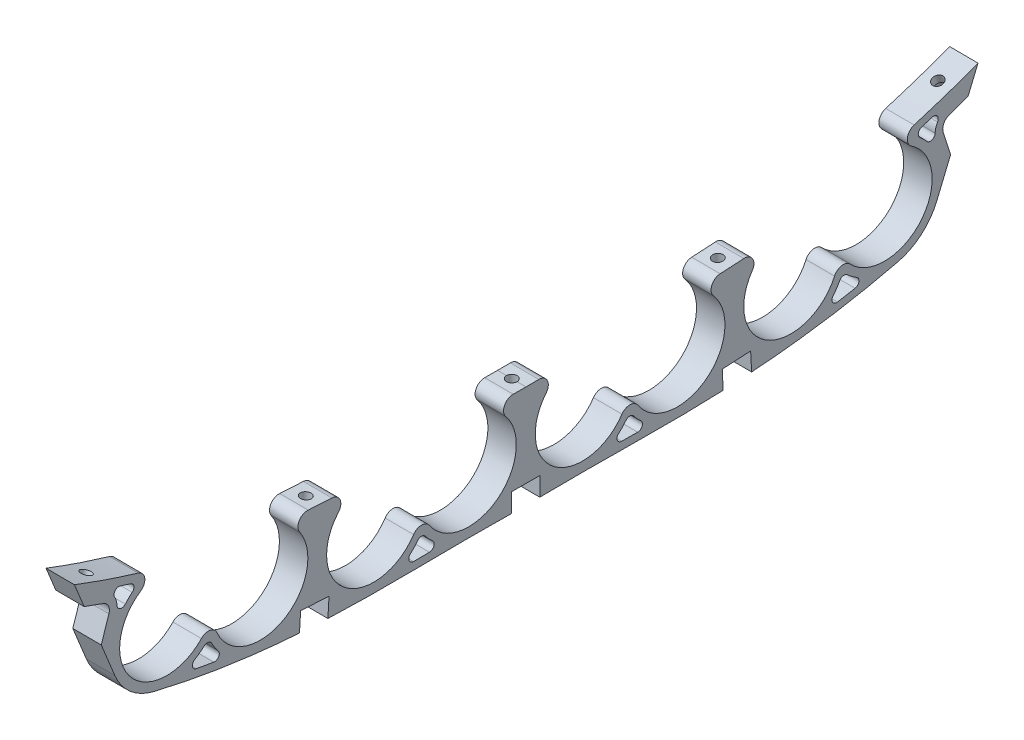
from build123d import *

# Parameters (mm, degrees)
BOSS_EXTRUDE2_DEPTH = 4.7625
CUT_EXTRUDE1_DEPTH  = 156.140004982
SKETCH3_R           = 1.778
CUT_EXTRUDE2_DEPTH  = 155.594652675
SKETCH4_R           = 1.778
CUT_EXTRUDE3_DEPTH  = 154.129887727
SKETCH5_R           = 3.175
CUT_EXTRUDE4_DEPTH  = 3.556
SKETCH6_R           = 1.778
CUT_EXTRUDE5_DEPTH  = 141.448581992


# Read off the part's stored shape, not the designer's step: Mirror1
with BuildPart() as part:
    # Sketch1 → Boss-Extrude2 (new, symmetric)
    with BuildSketch(Plane(origin=(-4.793989049, 0.020738597, -8e-09), x_dir=(-1.5740645192279891e-09, 3.5988585896806374e-12, 1.0), z_dir=(-0.9999906431736159, 0.00432591784689156, -1.5740653593461668e-09))):
        with BuildLine():
            Line((4.097149249, -41.793027475), (4.097149249, -13.684381562))
            add(Edge.make_bspline(
                [(-0.197992817, -13.658197906), (1.233887874, -13.669641114), (2.665596444, -13.67917089), (4.097149249, -13.684381562)],
                knots=[0.973473707, 0.973473707, 0.973473707, 0.973473707, 1, 1, 1, 1], degree=3))
            ThreePointArc((-0.197992817, -13.658197906), (-3.087878671, -15.463720469), (-2.678279853, -18.846556674))
            ThreePointArc((-2.678279853, -18.846556674), (-2.459422116, -19.119477593), (-2.246631473, -19.397154887))
            ThreePointArc((-2.246631473, -19.397154887), (0.109135751, -23.898660497), (0.922149671, -28.913857436))
            ThreePointArc((0.922149671, -28.913857436), (-10.330023088, -44.100861528), (-28.135499878, -37.75882074))
            ThreePointArc((-28.135499878, -37.75882074), (-30.788793596, -36.352857657), (-33.427092785, -37.786760419))
            ThreePointArc((-33.427092785, -37.786760419), (-56.000004834, -41.948908373), (-59.135509194, -19.210648844))
            add(Edge.make_bspline(
                [(-71.253324978, -18.51695643), (-67.22219572, -18.825212212), (-63.182502669, -19.053825628), (-59.135509194, -19.210648845)],
                knots=[0.535293106, 0.535293106, 0.535293106, 0.535293106, 0.609991772, 0.609991772, 0.609991772, 0.609991772], degree=3))
            ThreePointArc((-71.253324978, -18.51695643), (-69.473338821, -22.537426481), (-68.864440234, -26.891938239))
            ThreePointArc((-68.864440234, -26.891938239), (-81.471963152, -42.427034587), (-99.26938115, -33.286970841))
            ThreePointArc((-99.26938115, -33.286970841), (-101.634862692, -31.437323087), (-104.483804941, -32.386126439))
            ThreePointArc((-104.483804941, -32.386126439), (-127.878968465, -32.047286598), (-125.5261293, -8.76826951))
            add(Edge.make_bspline(
                [(-144.126574407, -2.696164985), (-141.693386447, -3.582520341), (-137.657540812, -4.990682155), (-131.449532285, -7.006389931), (-127.680307088, -8.145409373), (-125.5261293, -8.76826951)],
                knots=[0.075396222, 0.075396222, 0.075396222, 0.075396222, 0.123289108, 0.154539108, 0.195826457, 0.195826457, 0.195826457, 0.195826457], degree=3))
            Line((-144.126574407, -2.696164985), (-143.840043853, -3.392907472))
            Line((-143.840043853, -3.392907472), (-137.494598711, -5.665834335))
            ThreePointArc((-137.494598711, -5.665834335), (-135.715347538, -7.255363838), (-135.545390345, -9.635164949))
            Line((-135.545390345, -9.635164949), (-138.072044537, -17.41867238))
            Line((-138.072044537, -17.41867238), (-133.451933082, -28.653173909))
            ThreePointArc((-133.451933082, -28.653173909), (-128.289952657, -35.791230262), (-120.447393147, -39.802732565))
            add(Edge.make_bspline(
                [(-120.447393147, -39.802732565), (-119.532951115, -40.023476944), (-117.088169027, -40.601323697), (-110.953698267, -41.968369708), (-101.9631708, -43.710437587), (-90.800466979, -45.403836777), (-79.689088478, -46.662973433), (-68.62645086, -47.527275454), (-57.58924724, -48.037878216), (-46.678774083, -48.224931934), (-36.12400945, -48.204712413), (-25.891642086, -48.098211972), (-17.621930281, -48.025348577), (-11.245188421, -48.026081616), (-6.353163032, -48.062670944), (-2.777855823, -48.097005295), (-0.863208778, -48.112845404), (-0.665350758, -48.114448781)],
                knots=[0.270797205, 0.270797205, 0.270797205, 0.270797205, 0.286422205, 0.3125, 0.375, 0.4375, 0.5, 0.5625, 0.625, 0.6875, 0.75, 0.8125, 0.875, 0.90625, 0.9375, 0.96875, 0.972344137, 0.972344137, 0.972344137, 0.972344137], degree=3))
            Line((-0.665350758, -48.114448781), (-0.665350758, -43.034495919))
            Line((-0.665350758, -43.034495919), (-0.665350758, -41.793027475))
            Line((-0.665350758, -41.793027475), (4.097149249, -41.793027475))
        make_face()
        with BuildLine():
            add(Edge.make_bspline(
                [(-71.253324978, -18.51695643), (-67.22219572, -18.825212212), (-63.182502669, -19.053825628), (-59.135509194, -19.210648845)],
                knots=[0.535293106, 0.535293106, 0.535293106, 0.535293106, 0.609991772, 0.609991772, 0.609991772, 0.609991772], degree=3))
            ThreePointArc((-59.135509194, -19.210648844), (-58.89906526, -18.919941939), (-58.655825681, -18.634896774))
            ThreePointArc((-58.655825681, -18.634896774), (-58.126924891, -15.297918384), (-60.904121208, -13.373771446))
            add(Edge.make_bspline(
                [(-68.828218087, -12.920284085), (-66.193270159, -13.104549218), (-63.552061633, -13.254900638), (-60.904121208, -13.373771446)],
                knots=[0.547550637, 0.547550637, 0.547550637, 0.547550637, 0.597372825, 0.597372825, 0.597372825, 0.597372825], degree=3))
            ThreePointArc((-68.828218087, -12.920284085), (-71.806956564, -14.513315904), (-71.664664037, -17.888280516))
            ThreePointArc((-71.664664037, -17.888280516), (-71.455274959, -18.200184794), (-71.253324978, -18.51695643))
        make_face()
        with BuildLine():
            add(Edge.make_bspline(
                [(-144.126574407, -2.696164985), (-141.693386447, -3.582520341), (-137.657540812, -4.990682155), (-131.449532285, -7.006389931), (-127.680307088, -8.145409373), (-125.5261293, -8.76826951)],
                knots=[0.075396222, 0.075396222, 0.075396222, 0.075396222, 0.123289108, 0.154539108, 0.195826457, 0.195826457, 0.195826457, 0.195826457], degree=3))
            ThreePointArc((-125.5261293, -8.76826951), (-125.226031085, -8.549532847), (-124.92089854, -8.337875585))
            ThreePointArc((-124.92089854, -8.337875585), (-123.561886671, -5.224741567), (-125.794696479, -2.664843712))
            add(Edge.make_bspline(
                [(-147.137000396, 4.624142263), (-146.051301566, 4.203786415), (-144.963583265, 3.790748153), (-140.77844611, 2.231782933), (-137.662571865, 1.133761933), (-131.631205803, -0.876110443), (-128.721040833, -1.794426019), (-125.794696479, -2.664843712)],
                knots=[0.040485997, 0.040485997, 0.040485997, 0.040485997, 0.0625, 0.0625, 0.125, 0.125, 0.182529251, 0.182529251, 0.182529251, 0.182529251], degree=3))
            Line((-147.137000396, 4.624142263), (-144.126574407, -2.696164985))
        make_face()
    extrude(amount=BOSS_EXTRUDE2_DEPTH, both=True)

    # Sketch2 → Cut-Extrude1 (cut, symmetric)
    with BuildSketch(Plane(origin=(-9.556444487, 0.041340781, -1.5e-08), x_dir=(-1.574050630268585e-09, 6.809277426616461e-12, 1.0), z_dir=(-0.9999906431736159, 0.004325917846891559, -1.5740653585248619e-09))):
        with BuildLine():
            add(Edge.make_bspline(
                [(-128.288911655, -4.550972366), (-128.456661527, -4.498251993), (-129.003884742, -4.325677312), (-129.929643207, -4.030454177), (-130.927193912, -3.707456253), (-131.545372343, -3.504823848), (-131.785481644, -3.425746569)],
                knots=[0.050478375, 0.050478375, 0.050478375, 0.050478375, 0.053922838, 0.061719646, 0.069516453, 0.074472634, 0.074472634, 0.074472634, 0.074472634], degree=3))
            ThreePointArc((-131.785481644, -3.425746569), (-133.519336235, -3.938929798), (-133.647980943, -5.742553735))
            ThreePointArc((-133.647980943, -5.742553735), (-133.066520265, -7.097609192), (-132.851113315, -8.556331804))
            ThreePointArc((-132.851113315, -8.556331804), (-131.798846355, -10.023596818), (-130.05449481, -9.557367191))
            ThreePointArc((-130.05449481, -9.557367191), (-128.954006141, -8.372816688), (-127.753854614, -7.289363174))
            ThreePointArc((-127.753854614, -7.289363174), (-127.206840575, -5.761013448), (-128.288911655, -4.550972366))
        make_face()
        with BuildLine():
            ThreePointArc((-103.531454864, -35.014583834), (-105.046370881, -36.270658322), (-106.686675106, -37.357900572))
            ThreePointArc((-106.686675106, -37.357900572), (-107.445658928, -38.997677259), (-106.17831741, -40.285609518))
            add(Edge.make_bspline(
                [(-106.17831741, -40.285609518), (-105.689424337, -40.378639287), (-104.711253765, -40.562073564), (-103.243222942, -40.829245575), (-101.774672224, -41.088398866), (-100.795508991, -41.255698274), (-100.305943671, -41.337993115)],
                knots=[0.348717241, 0.348717241, 0.348717241, 0.348717241, 0.357017497, 0.365317753, 0.37361801, 0.381918266, 0.381918266, 0.381918266, 0.381918266], degree=3))
            ThreePointArc((-100.305943671, -41.337993115), (-98.66420871, -40.55966513), (-98.828229808, -38.750194154))
            ThreePointArc((-98.828229808, -38.750194154), (-100.027971586, -37.157075068), (-101.048395916, -35.443557359))
            ThreePointArc((-101.048395916, -35.443557359), (-102.184087051, -34.616438766), (-103.531454864, -35.014583834))
        make_face()
        with BuildLine():
            add(Edge.make_bspline(
                [(-71.583675399, -47.271919106), (-70.598994973, -47.341682326), (-67.425842782, -47.552597161), (-64.255834735, -47.719787794), (-62.074191054, -47.815364726)],
                knots=[0.545803026, 0.545803026, 0.545803026, 0.545803026, 0.5625, 0.599629943, 0.599629943, 0.599629943, 0.599629943], degree=3))
            Line((-62.074191054, -47.815364726), (-61.714235338, -41.507290745))
            Line((-61.714235338, -41.507290745), (-71.223765685, -40.964651294))
            Line((-71.223765685, -40.964651294), (-71.583675399, -47.271919106))
        make_face()
        with BuildLine():
            ThreePointArc((-32.028379906, -40.207372166), (-33.189236423, -41.591748315), (-34.480162394, -42.855708484))
            ThreePointArc((-34.480162394, -42.855708484), (-34.908363074, -44.612613191), (-33.413774747, -45.630589469))
            add(Edge.make_bspline(
                [(-33.413774747, -45.630589469), (-32.965810837, -45.626992717), (-32.071534178, -45.619472638), (-30.73513395, -45.607427742), (-29.403652527, -45.594865531), (-28.519261525, -45.586295989), (-28.077877376, -45.582002891)],
                knots=[0.766813177, 0.766813177, 0.766813177, 0.766813177, 0.774973862, 0.783134546, 0.79129523, 0.799455915, 0.799455915, 0.799455915, 0.799455915], degree=3))
            ThreePointArc((-28.077877376, -45.582002891), (-26.60398535, -44.544165428), (-27.050423166, -42.797695394))
            ThreePointArc((-27.050423166, -42.797695394), (-28.342931358, -41.555770069), (-29.508573761, -40.194067557))
            ThreePointArc((-29.508573761, -40.194067557), (-30.771759408, -39.579021592), (-32.028379906, -40.207372166))
        make_face()
    extrude(amount=CUT_EXTRUDE1_DEPTH, both=True, mode=Mode.SUBTRACT)

    # Sketch3 → Cut-Extrude2 (cut, through all)
    with BuildSketch(Plane(origin=(-0.180793203, -41.792636425, 0), x_dir=(0.9999906431736159, -0.0043259178468915615, -1.3888719940127347e-14), z_dir=(-0.0043259178468915615, -0.9999906431736159, -3.2105533385859324e-12))):
        with Locations((-4.794033913, 4.097149242)):
            Circle(SKETCH3_R)
    extrude(amount=-CUT_EXTRUDE2_DEPTH, mode=Mode.SUBTRACT)

    # Sketch4 → Cut-Extrude3 (cut, through all)
    with BuildSketch(Plane(origin=(-0.194158984, -44.882306557, -2.561129434), x_dir=(-0.9999906735425043, 0.004311878052904483, 0.00024603996752121634), z_dir=(-0.004318891988536284, -0.9983665478510362, -0.05697002109878658))):
        with Locations(Location((4.777085058, 64.011158923, 0), (0, 0, 89.999999444))):
            Circle(SKETCH4_R)
    extrude(amount=-CUT_EXTRUDE3_DEPTH, mode=Mode.SUBTRACT)

    # Sketch5 → Cut-Extrude4 (cut)
    with BuildSketch(Plane(origin=(-0.210548141, -48.670872964, -17.433980944), x_dir=(0.999991707196866, -0.003833989132161011, -0.0013733407559271694), z_dir=(-0.004072534529923516, -0.9414180062743198, -0.3372173659896347))):
        with Locations(Location((-4.59625756, -130.848571229, 0), (0, 0, 270))):
            Circle(SKETCH5_R)
    extrude(amount=-CUT_EXTRUDE4_DEPTH, mode=Mode.SUBTRACT)

    # Sketch6 → Cut-Extrude5 (cut, through all)
    with BuildSketch(Plane(origin=(-0.196066208, -45.323190534, -16.23483599), x_dir=(-0.999991707196866, 0.0038339891321610103, 0.0013733407559271692), z_dir=(-0.004072534529923516, -0.9414180062743199, -0.33721736598963475))):
        with Locations(Location((4.59625756, 130.848571229, 0), (0, 0, 90))):
            Circle(SKETCH6_R)
    extrude(amount=-CUT_EXTRUDE5_DEPTH, mode=Mode.SUBTRACT)

    # Mirror1: part across plane


with BuildPart() as part_1:
    add(part.part)
    add(part.part.mirror(Plane(origin=(-0.031533617, 0.000136413, 4.097149249), x_dir=(1.0, 0, 1.5740645186890284e-09), z_dir=(1.5740645186890284e-09, -3.5989831772955242e-12, -1.0))))


solid = part_1.part
